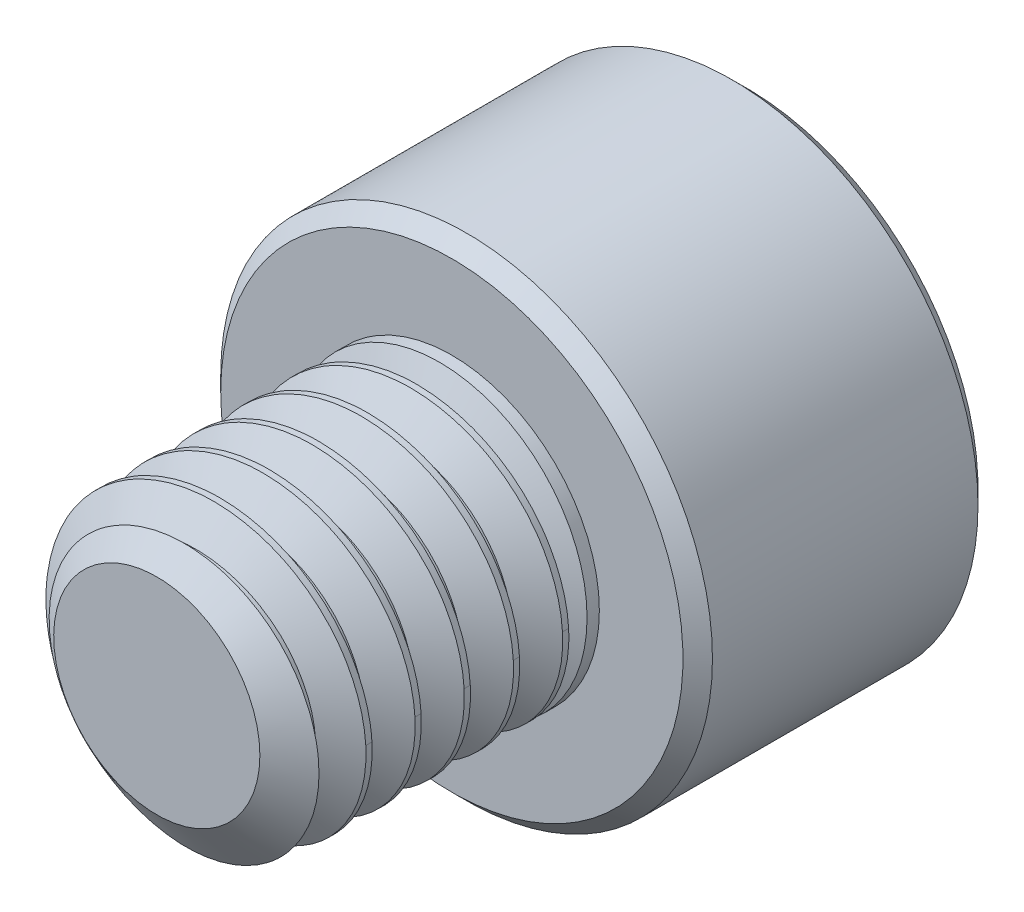
from build123d import *

# Parameters (mm, degrees)
SKETCH1_R          = 3
EXTRUDE1_DEPTH     = 6
CUT_SWEEP1_PITCH   = 1
SKETCH6_R          = 5
EXTRUDE2_DEPTH     = 6
CUT_EXTRUDE1_DEPTH = 3.75
CHAMFER1_SIZE      = 0.3


with BuildPart() as part:
    # Sketch1 → Extrude1 (new body)
    with BuildSketch(Plane.XY):
        Circle(SKETCH1_R)
    extrude(amount=-EXTRUDE1_DEPTH)

    # Cut-Sweep1: the profile of Sketch3 profile screwed along a right-hand helix of 7 turns, 6 arcs to a turn; built about Z, then put on its axis
    cut_sweep1_z = Axis((0, 0, 0), (0, 0, 1))
    cut_sweep1_corners = [(3.0003, 0, -0.875173205), (2.350480947, 0, -0.5), (2.350480947, 0, -0.375), (3.0003, 0, 0.000173205)]
    with BuildLine(mode=Mode.PRIVATE) as cut_sweep1_profile:
        Line(cut_sweep1_corners[0], cut_sweep1_corners[1])
        Line(cut_sweep1_corners[1], cut_sweep1_corners[2])
        Line(cut_sweep1_corners[2], cut_sweep1_corners[3])
        Line(cut_sweep1_corners[3], cut_sweep1_corners[0])
    cut_sweep1_cap = Face(cut_sweep1_profile.wire())
    cut_sweep1_turn_angles = [0, 30, 60, 90, 120, 150, 180, 210, 240, 270, 300, 330, 360]
    cut_sweep1_turn_weights = [1, 0.8660254037844387, 1, 0.8660254037844387, 1, 0.8660254037844387, 1, 0.8660254037844387, 1, 0.8660254037844387, 1, 0.8660254037844387, 1]
    cut_sweep1_turn_rails = [Edge.make_bspline([Vector(p[0], p[1], 0).rotate(cut_sweep1_z, cut_sweep1_turn_angles[k]) / cut_sweep1_turn_weights[k] + Vector(0, 0, p[2] + CUT_SWEEP1_PITCH * cut_sweep1_turn_angles[k] / 360) for k in range(13)], [0, 0, 0, 1, 1, 2, 2, 3, 3, 4, 4, 5, 5, 6, 6, 6], 2, cut_sweep1_turn_weights) for p in cut_sweep1_corners]
    cut_sweep1_turn_sides = [Face.make_surface_from_curves(cut_sweep1_turn_rails[p[0]], cut_sweep1_turn_rails[p[1]]) for p in [(0, 1), (1, 2), (2, 3), (3, 0)]]
    cut_sweep1 = Plane(origin=(0, 0, 0), x_dir=(0, 1, 0), z_dir=(0, 0, -1)) * Solid(Shell([*[p.moved(Location((0, 0, CUT_SWEEP1_PITCH * i))) for i in range(7) for p in cut_sweep1_turn_sides], cut_sweep1_cap, cut_sweep1_cap.rotate(cut_sweep1_z, 2520).moved(Location((0, 0, CUT_SWEEP1_PITCH * 2520 / 360)))]))
    add(cut_sweep1, mode=Mode.SUBTRACT)

    # Sketch4 → Cut-Revolve1 (revolve, cut)
    with BuildSketch(Plane(origin=(0, 0, 0), x_dir=(0, 0, -1), z_dir=(1, 0, 0)), mode=Mode.PRIVATE) as cut_revolve1_sk:
        Polygon((0.632650852, 3), (0, 2.096480947), (0, 3), align=None)
    revolve(cut_revolve1_sk.sketch.rotate(Axis((0, 0, 0), (0, 0, -1)), 244.349292568), axis=Axis((0, 0, 0), (0, 0, -1)), mode=Mode.SUBTRACT)

    # Sketch6 → Extrude2 (add)
    with BuildSketch(Plane(origin=(0, 0, -6), x_dir=(-1, 0, 0), z_dir=(0, 0, -1))):
        Circle(SKETCH6_R)
    extrude(amount=EXTRUDE2_DEPTH)

    # Sketch7 → Cut-Extrude1 (cut)
    with BuildSketch(Plane(origin=(0, 0, -12), x_dir=(-1, 0, 0), z_dir=(0, 0, -1))):
        Polygon((0, 2.886751346), (-2.5, 1.443375673), (-2.5, -1.443375673), (0, -2.886751346), (2.5, -1.443375673), (2.5, 1.443375673), align=None)
    extrude(amount=-CUT_EXTRUDE1_DEPTH, mode=Mode.SUBTRACT)

    # Cut-Extrude2 cone 1 section (through the dimple's axis) → Cut-Extrude2 (revolve, cut)
    with BuildSketch(Plane(origin=(0, 0, -12), x_dir=(0, 1, 0), z_dir=(1, 0, 0))):
        Polygon((0, 0), (2.886751346, 0), (0, 2.886751346), align=None)
    revolve(axis=Axis((0, 0, -12), (0, 0, 1)), mode=Mode.SUBTRACT)

    # Chamfer1
    chamfer1_edges = [part.edges().sort_by_distance(p)[0] for p in [
        (5, 0, -6),
        (5, 0, -12),
    ]]
    chamfer(chamfer1_edges, length=CHAMFER1_SIZE)

    # Sketch10 → Revolve1 (revolve)
    with BuildSketch(Plane(origin=(0, 0, 0), x_dir=(0, 0, -1), z_dir=(1, 0, 0)), mode=Mode.PRIVATE) as revolve1_sk:
        Polygon((6, 3), (6, 0), (4.507359313, 0), (5.75, 3), align=None)
    revolve(revolve1_sk.sketch.rotate(Axis((0, 0, -6), (0, 0, 1)), 270), axis=Axis((0, 0, -6), (0, 0, 1)))


solid = part.part
